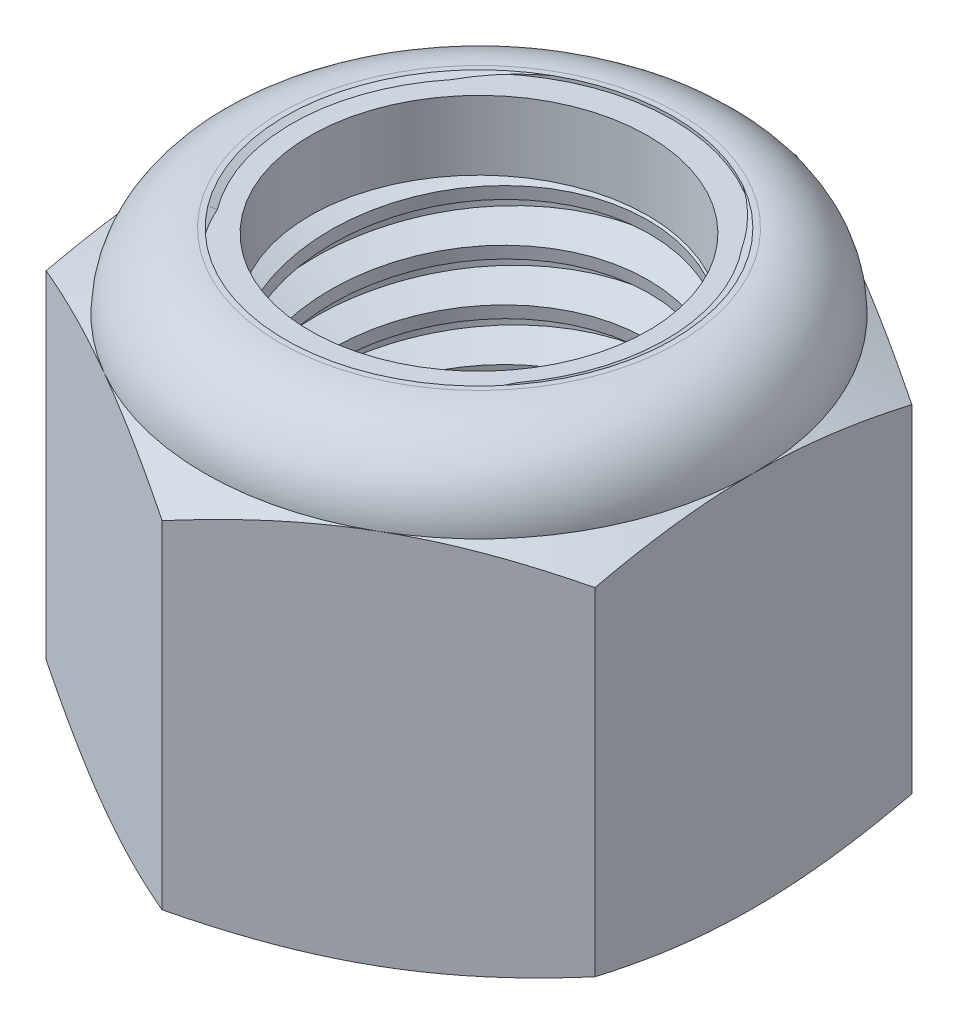
from build123d import *

# Parameters (mm, degrees)
EXTRUDE1_DEPTH       = 22.225
SKETCH2_W            = 9.525
SKETCH2_H            = 22.225
LPATTERN1_COUNT      = 9
LPATTERN1_PITCH      = 2.54
LPATTERN1_COUNT_DIR2 = 2
LPATTERN1_PITCH_DIR2 = 2.54


with BuildPart() as part:
    # Sketch1 → Extrude1 (new body)
    with BuildSketch(Plane(origin=(0, 0, 0), x_dir=(1, 0, 0), z_dir=(0, 1, 0))):
        Polygon((0, 15.58124039), (-13.49375, 7.790620195), (-13.49375, -7.790620195), (0, -15.58124039), (13.49375, -7.790620195), (13.49375, 7.790620195), align=None)
    extrude(amount=EXTRUDE1_DEPTH)

    # Sketch4 → Cut-Revolve2 (revolve, cut)
    with BuildSketch(Plane(origin=(0, 0, 0), x_dir=(0, 0, -1), z_dir=(1, 0, 0))):
        Polygon((0, 22.225), (9.525, 22.225), (8.309111622, 21.658021938), (8.309111622, 0.566978062), (9.525, 0), (0, 0), align=None)
    revolve(axis=Axis((0, 22.225, 0), (0, 1, 0)), mode=Mode.SUBTRACT)


with BuildPart() as body_2:
    # Sketch2 → Revolve1 (revolve)
    with BuildSketch(Plane(origin=(0, 0, 0), x_dir=(0, 0, -1), z_dir=(1, 0, 0))):
        with Locations((4.7625, 11.1125)):
            Rectangle(SKETCH2_W, SKETCH2_H)
    revolve(axis=Axis((0, -9.525, 0), (0, 1, 0)))

    # Sketch3 → Cut-Revolve1 (revolve, cut)
    with BuildSketch(Plane(origin=(0, 0, 0), x_dir=(0, 0, -1), z_dir=(1, 0, 0))):
        Polygon((9.566961981, 21.910285142), (9.860695849, 19.707281132), (8.393035584, 20.31236757), (8.309111622, 20.941797287), align=None)
    cut_revolve1 = revolve(axis=Axis((0, 22.225, 0.361519207), (0, -0.9912279006826347, -0.1321637200910183)), mode=Mode.SUBTRACT)

    # LPattern1: Cut-Revolve1 9 × 2
    with Locations(*[Vector(0, -1, 0) * (i * LPATTERN1_PITCH) + Vector(0, 1, 0) * (j * LPATTERN1_PITCH_DIR2) for i in range(LPATTERN1_COUNT) for j in range(LPATTERN1_COUNT_DIR2) if (i, j) != (0, 0)]):
        add(cut_revolve1, mode=Mode.SUBTRACT)


with BuildPart() as part_1:
    add(part.part)

    # Combine1: cut body 2
    add(body_2.part, mode=Mode.SUBTRACT)

    # Sketch5 → Cut-Revolve3 (revolve, cut)
    with BuildSketch(Plane(origin=(0, 0, 0), x_dir=(0, 0, -1), z_dir=(1, 0, 0))):
        with BuildLine():
            Line((0, 0), (13.49375, 0))
            Line((13.49375, 0), (15.58124039, 0.973412755))
            Line((15.58124039, 0.973412755), (15.58124039, 17.547420578))
            Line((15.58124039, 17.547420578), (13.49375, 18.520833333))
            ThreePointArc((13.49375, 18.520833333), (12.408824702, 21.140074702), (9.789583333, 22.225))
            Line((9.789583333, 22.225), (9.789583333, 23.495))
            Line((9.789583333, 23.495), (16.85124039, 23.495))
            Line((16.85124039, 23.495), (16.85124039, -1.27))
            Line((16.85124039, -1.27), (0, -1.27))
            Line((0, -1.27), (0, 0))
        make_face()
    revolve(axis=Axis((0, 0, 0), (0, 1, 0)), mode=Mode.SUBTRACT)

    # Sketch6 → Cut-Revolve4 (revolve, cut)
    with BuildSketch(Plane(origin=(0, 0, 0), x_dir=(0, 0, -1), z_dir=(1, 0, 0))):
        with BuildLine():
            Line((0, 18.520833333), (13.34135, 18.520833333))
            ThreePointArc((13.34135, 18.520833333), (12.301061629, 21.032311629), (9.789583333, 22.0726))
            Line((9.789583333, 22.0726), (9.049347478, 22.0726))
            Line((9.049347478, 22.0726), (9.049347478, 23.495))
            Line((9.049347478, 23.495), (0, 23.495))
            Line((0, 23.495), (0, 18.520833333))
        make_face()
    revolve(axis=Axis((0, 23.495, 0), (0, 1, 0)), mode=Mode.SUBTRACT)


with BuildPart() as body_2_2:
    # Sketch7 → Revolve2 (revolve)
    with BuildSketch(Plane(origin=(0, 0, 0), x_dir=(0, 0, -1), z_dir=(1, 0, 0))):
        with BuildLine():
            Line((8.309111622, 18.597033333), (13.264314577, 18.597033333))
            ThreePointArc((13.264314577, 18.597033333), (12.220090017, 21.005224791), (9.789583333, 21.9964))
            Line((9.789583333, 21.9964), (8.309111622, 21.9964))
            Line((8.309111622, 21.9964), (8.309111622, 18.597033333))
        make_face()
    revolve(axis=Axis((0, 18.597033333, 0), (0, 1, 0)))


solid = Compound([part_1.part, body_2_2.part])
